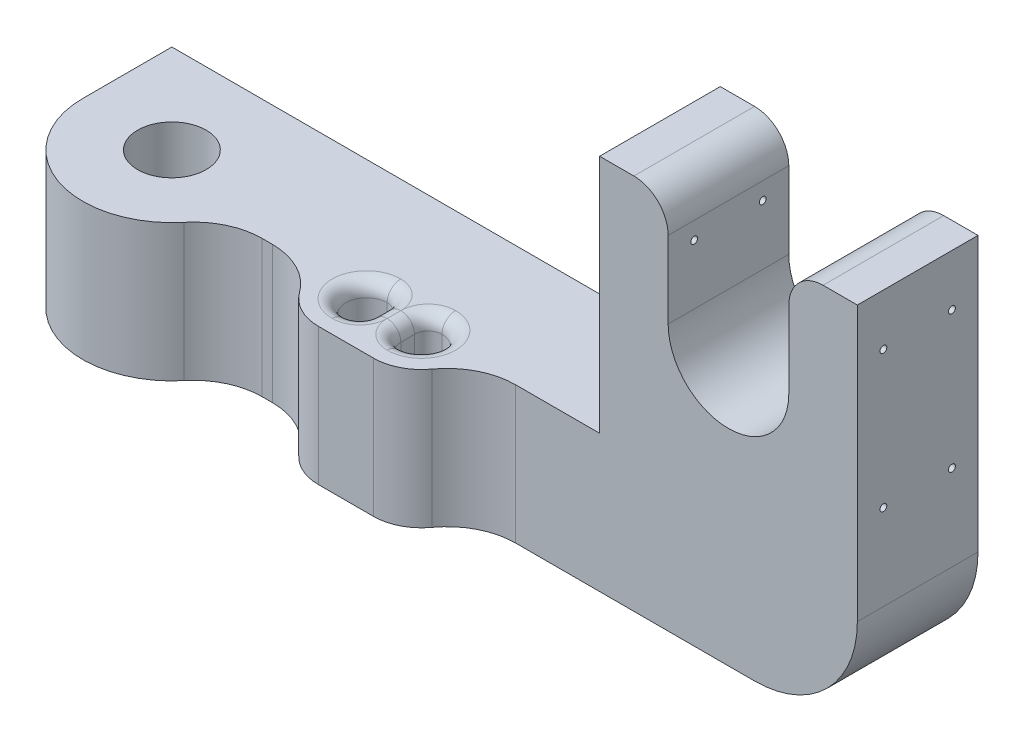
from build123d import *
from build123d.topology import SkipClean

# Parameters (mm, degrees)
BOSS_EXTRUDE1_DEPTH = 11.176
CUT_EXTRUDE3_DEPTH  = 145.042188445
SKETCH2_4_R         = 16.51
SKETCH2_4_R_2       = 6.35
BOSS_EXTRUDE2_DEPTH = 25.4
SKETCH3_R           = 0.635
CUT_EXTRUDE4_DEPTH  = 119.599506053
CUT_EXTRUDE5_DEPTH  = 146.259799711
BOSS_EXTRUDE3_DEPTH = 25.4
FILLET5_R           = 2.54
FILLET6_R           = 19.05
FILLET9_R           = 12.7


with BuildPart() as part:
    # Sketch1 → Boss-Extrude1 (new, symmetric)
    with BuildSketch(Plane.XY):
        with BuildLine():
            Line((-23.876, -12.7), (-23.876, 57.15))
            Line((-23.876, 57.15), (-17.526, 57.15))
            ThreePointArc((-17.526, 57.15), (-13.035871939, 55.290128061), (-11.176, 50.8))
            Line((-11.176, 50.8), (-11.176, 36.576))
            ThreePointArc((-11.176, 36.576), (0, 25.4), (11.176, 36.576))
            Line((11.176, 36.576), (11.176, 50.8))
            ThreePointArc((11.176, 50.8), (13.035871939, 55.290128061), (17.526, 57.15))
            Line((17.526, 57.15), (23.876, 57.15))
            Line((23.876, 57.15), (23.876, 12.7))
            Line((23.876, 12.7), (125.476, 12.7))
            Line((125.476, 12.7), (125.476, -12.7))
            Line((125.476, -12.7), (-23.876, -12.7))
        make_face()
    extrude(amount=BOSS_EXTRUDE1_DEPTH, both=True)

    # Sketch2 → Cut-Extrude3 (cut, through all)
    with BuildSketch(Plane(origin=(0, -12.7, 0), x_dir=(-1, 0, 0), z_dir=(0, -1, 0))):
        with BuildLine():
            ThreePointArc((-124.4078631, -11.176), (-125.206770606, -8.303422521), (-125.476, -5.334))
            Line((-125.476, -5.334), (-125.476, -11.176))
            Line((-125.476, -11.176), (-124.4078631, -11.176))
        make_face()
        with BuildLine():
            ThreePointArc((-106.477318421, -11.176), (-108.966, 1.016), (-111.454681579, -11.176))
            Line((-111.454681579, -11.176), (-106.477318421, -11.176))
        make_face()
    extrude(amount=-CUT_EXTRUDE3_DEPTH, mode=Mode.SUBTRACT)

    # Sketch2<4> → Boss-Extrude2 (add)
    with SkipClean():  # the faces are left unmerged after this step: merging them gives an invalid solid
        with BuildSketch(Plane(origin=(0, -12.7, 0), x_dir=(-1, 0, 0), z_dir=(0, -1, 0))):
            with Locations((-108.966, -5.334)):
                Circle(SKETCH2_4_R)
            with Locations(Location((-108.966, -5.334, 0), (0, 0, 180))):
                Circle(SKETCH2_4_R_2, mode=Mode.SUBTRACT)
        extrude(amount=-BOSS_EXTRUDE2_DEPTH)

    # Sketch3 → Cut-Extrude4 (cut, through all)
    with SkipClean():  # the faces are left unmerged after this step: merging them gives an invalid solid
        with BuildSketch(Plane(origin=(23.876, 0, 0), x_dir=(0, 0, -1), z_dir=(1, 0, 0))):
            with Locations((6.35, 22.225)):
                Circle(SKETCH3_R)
            with Locations(Location((-6.35, 22.225, 0), (0, 0, 180))):
                Circle(SKETCH3_R)
            with Locations(Location((6.35, 47.625, 0), (0, 0, 270))):
                Circle(SKETCH3_R)
            with Locations((-6.35, 47.625)):
                Circle(SKETCH3_R)
        extrude(amount=-CUT_EXTRUDE4_DEPTH, mode=Mode.SUBTRACT)

    # Sketch4 → Cut-Extrude5 (cut, through all)
    with SkipClean():  # the faces are left unmerged after this step: merging them gives an invalid solid
        with BuildSketch(Plane(origin=(0, -12.7, 0), x_dir=(-1, 0, 0), z_dir=(0, -1, 0))):
            with BuildLine():
                Line((-59.436, -7.366), (-59.436, -11.176))
                Line((-59.436, -11.176), (-53.086, -11.176))
                ThreePointArc((-53.086, -11.176), (-54.201923164, -8.481923164), (-56.896, -7.366))
                Line((-56.896, -7.366), (-59.436, -7.366))
            make_face()
            with BuildLine():
                Line((-70.866, -11.176), (-64.516, -11.176))
                Line((-64.516, -11.176), (-64.516, -7.366))
                Line((-64.516, -7.366), (-67.056, -7.366))
                ThreePointArc((-67.056, -7.366), (-69.750076836, -8.481923164), (-70.866, -11.176))
            make_face()
            with BuildLine():
                Line((-59.436, -11.176), (-59.436, -14.986))
                Line((-59.436, -14.986), (-56.896, -14.986))
                ThreePointArc((-56.896, -14.986), (-54.201923164, -13.870076836), (-53.086, -11.176))
                Line((-53.086, -11.176), (-59.436, -11.176))
            make_face()
            with BuildLine():
                Line((-64.516, -14.986), (-64.516, -11.176))
                Line((-64.516, -11.176), (-70.866, -11.176))
                ThreePointArc((-70.866, -11.176), (-69.750076836, -13.870076836), (-67.056, -14.986))
                Line((-67.056, -14.986), (-64.516, -14.986))
            make_face()
        extrude(amount=-CUT_EXTRUDE5_DEPTH, mode=Mode.SUBTRACT)

    # Sketch4<3> → Boss-Extrude3 (add)
    with SkipClean():  # the faces are left unmerged after this step: merging them gives an invalid solid
        with BuildSketch(Plane(origin=(0, -12.7, 0), x_dir=(-1, 0, 0), z_dir=(0, -1, 0))):
            with BuildLine():
                Line((-56.896, -14.986), (-59.436, -14.986))
                Line((-59.436, -14.986), (-59.436, -11.176))
                Line((-59.436, -11.176), (-64.516, -11.176))
                Line((-64.516, -11.176), (-64.516, -14.986))
                Line((-64.516, -14.986), (-67.056, -14.986))
                ThreePointArc((-67.056, -14.986), (-69.750076836, -13.870076836), (-70.866, -11.176))
                Line((-70.866, -11.176), (-84.515613398, -11.176))
                ThreePointArc((-84.515613398, -11.176), (-78.753082295, -12.558613584), (-74.245252576, -16.405411765))
                ThreePointArc((-74.245252576, -16.405411765), (-71.089771772, -19.098170491), (-67.056, -20.066))
                Line((-67.056, -20.066), (-56.896, -20.066))
                ThreePointArc((-56.896, -20.066), (-52.862228228, -19.098170491), (-49.706747424, -16.405411765))
                ThreePointArc((-49.706747424, -16.405411765), (-45.198917705, -12.558613584), (-39.436386602, -11.176))
                Line((-39.436386602, -11.176), (-53.086, -11.176))
                ThreePointArc((-53.086, -11.176), (-54.201923164, -13.870076836), (-56.896, -14.986))
            make_face()
        extrude(amount=-BOSS_EXTRUDE3_DEPTH)

    # Fillet5
    fillet5_edges = [part.edges().sort_by_distance(p)[0] for p in [
        (54.201923164, -12.7, 13.870076836),
        (54.201923164, 12.7, 8.481923164),
        (69.750076836, -12.7, 8.481923164),
        (69.750076836, 12.7, 8.481923164),
        (59.436, 0, 14.986),
        (59.436, -12.7, 13.081),
        (59.436, 12.7, 9.271),
        (64.516, 0, 14.986),
        (64.516, 12.7, 13.081),
        (64.516, -12.7, 13.081),
        (59.436, 0, 7.366),
        (64.516, 0, 7.366),
    ]]
    fillet(fillet5_edges, radius=FILLET5_R - 0.0001)  # a hair under: the kernel refuses the full size


with BuildPart() as body_2:
    # Mirror1: mirrored copy
    add(part.part.mirror(Plane(origin=(0, 0, 0), x_dir=(0, 0, 1), z_dir=(1, 0, 0))))

    # Fillet6
    fillet6_edges = [body_2.edges().sort_by_distance(p)[0] for p in [
        (23.876, -12.7, 0),
    ]]
    fillet(fillet6_edges, radius=FILLET6_R)

    # Fillet9
    fillet9_edges = [body_2.edges().sort_by_distance(p)[0] for p in [
        (-93.5241369, 0, 11.176),
    ]]
    fillet(fillet9_edges, radius=FILLET9_R)


solid = body_2.part
